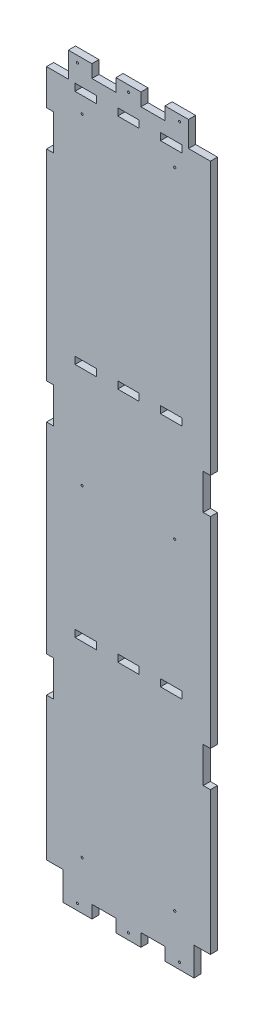
from build123d import *

# Parameters (mm, degrees)
BOSS_EXTRUDE1_DEPTH          = 10
SKETCH2_W                    = 33.8
SKETCH2_H                    = 18
CUT_EXTRUDE1_DEPTH           = 38
SKETCH3_W                    = 23
SKETCH3_H                    = 40.02
CUT_EXTRUDE2_DEPTH           = 51
CAVITY1_START                = -212
CAVITY1_OUTLINE_W            = 50
CAVITY1_OUTLINE_H            = 10
CAVITY1_DEPTH                = 10
CAVITY1_START_2              = 8
CAVITY1_2_OUTLINE_W          = 50
CAVITY1_2_OUTLINE_H          = 10
CAVITY1_2_DEPTH              = 10
CAVITY1_START_3              = -172
CAVITY1_3_OUTLINE_W          = 10
CAVITY1_3_OUTLINE_H          = 10
CAVITY1_3_DEPTH              = 30
CAVITY1_START_4              = -112
CAVITY1_4_OUTLINE_W          = 10
CAVITY1_4_OUTLINE_H          = 10
CAVITY1_4_DEPTH              = 30
CAVITY1_START_5              = -52
CAVITY1_5_OUTLINE_W          = 10
CAVITY1_5_OUTLINE_H          = 10
CAVITY1_5_DEPTH              = 30
F_3_0_3_DIAMETER_HOLE1_D     = 3
F_3_0_3_DIAMETER_HOLE1_DEPTH = 15
F_3_0_3_DIAMETER_HOLE1_TIP   = 0.901290929


# Read off the part's stored shape, not the designer's step: Cavity1
with BuildPart() as part:
    # Sketch1 → Boss-Extrude1 (new body)
    with BuildSketch(Plane.XY):
        Polygon((18, -35.36), (-12.7, -35.36), (-12.7, 0), (-181.3, 0), (-181.3, -35.36), (-212, -35.36), (-212, -1039.94), (18, -1039.94), align=None)
    extrude(amount=-BOSS_EXTRUDE1_DEPTH)

    # Sketch2 → Cut-Extrude1 (cut)
    with BuildSketch(Plane.XY):
        with Locations((-62.6, -9)):
            Rectangle(SKETCH2_W, SKETCH2_H)
        with Locations((-131.4, -9)):
            Rectangle(SKETCH2_W, SKETCH2_H)
        with Locations((-131.4, -1030.94)):
            Rectangle(SKETCH2_W, SKETCH2_H)
        with Locations((-62.6, -1030.94)):
            Rectangle(SKETCH2_W, SKETCH2_H)
    extrude(amount=-CUT_EXTRUDE1_DEPTH, mode=Mode.SUBTRACT)

    # Sketch3 → Cut-Extrude2 (cut)
    with BuildSketch(Plane.XY):
        with Locations((-200.5, -1019.93)):
            Rectangle(SKETCH3_W, SKETCH3_H)
        with Locations((6.5, -1019.93)):
            Rectangle(SKETCH3_W, SKETCH3_H)
    extrude(amount=-CUT_EXTRUDE2_DEPTH, mode=Mode.SUBTRACT)

    # Cavity1 outline → Cavity1 (cut)
    with BuildSketch(Plane.YZ.offset(CAVITY1_START)):
        with Locations((-110.46, -5)):
            Rectangle(CAVITY1_OUTLINE_W, CAVITY1_OUTLINE_H)
        with Locations((-442.46, -5)):
            Rectangle(CAVITY1_OUTLINE_W, CAVITY1_OUTLINE_H)
        with Locations((-774.46, -5)):
            Rectangle(CAVITY1_OUTLINE_W, CAVITY1_OUTLINE_H)
    extrude(amount=CAVITY1_DEPTH, mode=Mode.SUBTRACT)

    # Cavity1 2 outline → Cavity1 2 (cut)
    with BuildSketch(Plane.YZ.offset(CAVITY1_START_2)):
        with Locations((-442.46, -5)):
            Rectangle(CAVITY1_2_OUTLINE_W, CAVITY1_2_OUTLINE_H)
        with Locations((-774.46, -5)):
            Rectangle(CAVITY1_2_OUTLINE_W, CAVITY1_2_OUTLINE_H)
    extrude(amount=CAVITY1_2_DEPTH, mode=Mode.SUBTRACT)

    # Cavity1 3 outline → Cavity1 3 (cut)
    with BuildSketch(Plane.YZ.offset(CAVITY1_START_3)):
        with Locations((-40.46, -5)):
            Rectangle(CAVITY1_3_OUTLINE_W, CAVITY1_3_OUTLINE_H)
        with Locations((-372.46, -5)):
            Rectangle(CAVITY1_3_OUTLINE_W, CAVITY1_3_OUTLINE_H)
        with Locations((-704.46, -5)):
            Rectangle(CAVITY1_3_OUTLINE_W, CAVITY1_3_OUTLINE_H)
    extrude(amount=CAVITY1_3_DEPTH, mode=Mode.SUBTRACT)

    # Cavity1 4 outline → Cavity1 4 (cut)
    with BuildSketch(Plane.YZ.offset(CAVITY1_START_4)):
        with Locations((-40.46, -5)):
            Rectangle(CAVITY1_4_OUTLINE_W, CAVITY1_4_OUTLINE_H)
        with Locations((-372.46, -5)):
            Rectangle(CAVITY1_4_OUTLINE_W, CAVITY1_4_OUTLINE_H)
        with Locations((-704.46, -5)):
            Rectangle(CAVITY1_4_OUTLINE_W, CAVITY1_4_OUTLINE_H)
    extrude(amount=CAVITY1_4_DEPTH, mode=Mode.SUBTRACT)

    # Cavity1 5 outline → Cavity1 5 (cut)
    with BuildSketch(Plane.YZ.offset(CAVITY1_START_5)):
        with Locations((-40.46, -5)):
            Rectangle(CAVITY1_5_OUTLINE_W, CAVITY1_5_OUTLINE_H)
        with Locations((-372.46, -5)):
            Rectangle(CAVITY1_5_OUTLINE_W, CAVITY1_5_OUTLINE_H)
        with Locations((-704.46, -5)):
            Rectangle(CAVITY1_5_OUTLINE_W, CAVITY1_5_OUTLINE_H)
    extrude(amount=CAVITY1_5_DEPTH, mode=Mode.SUBTRACT)

    # Ø3.0 (3) Diameter Hole1
    with Locations(Plane(origin=(0, 0, -10), x_dir=(-1, 0, 0), z_dir=(0, 0, -1))):
        with Locations((162, -971.94), (32, -68), (162, -68), (32, -971.94), (32, -519.97), (162, -519.97), (97, -1030.94), (168.65, -1030.94), (25.35, -1030.94), (25.35, -9), (168.65, -9), (97, -9)):
            Hole(F_3_0_3_DIAMETER_HOLE1_D / 2, depth=F_3_0_3_DIAMETER_HOLE1_DEPTH)
            with Locations((0, 0, -(F_3_0_3_DIAMETER_HOLE1_DEPTH + F_3_0_3_DIAMETER_HOLE1_TIP / 2))):  # 118° drill point
                Cone(0, F_3_0_3_DIAMETER_HOLE1_D / 2, F_3_0_3_DIAMETER_HOLE1_TIP, mode=Mode.SUBTRACT)


solid = part.part
